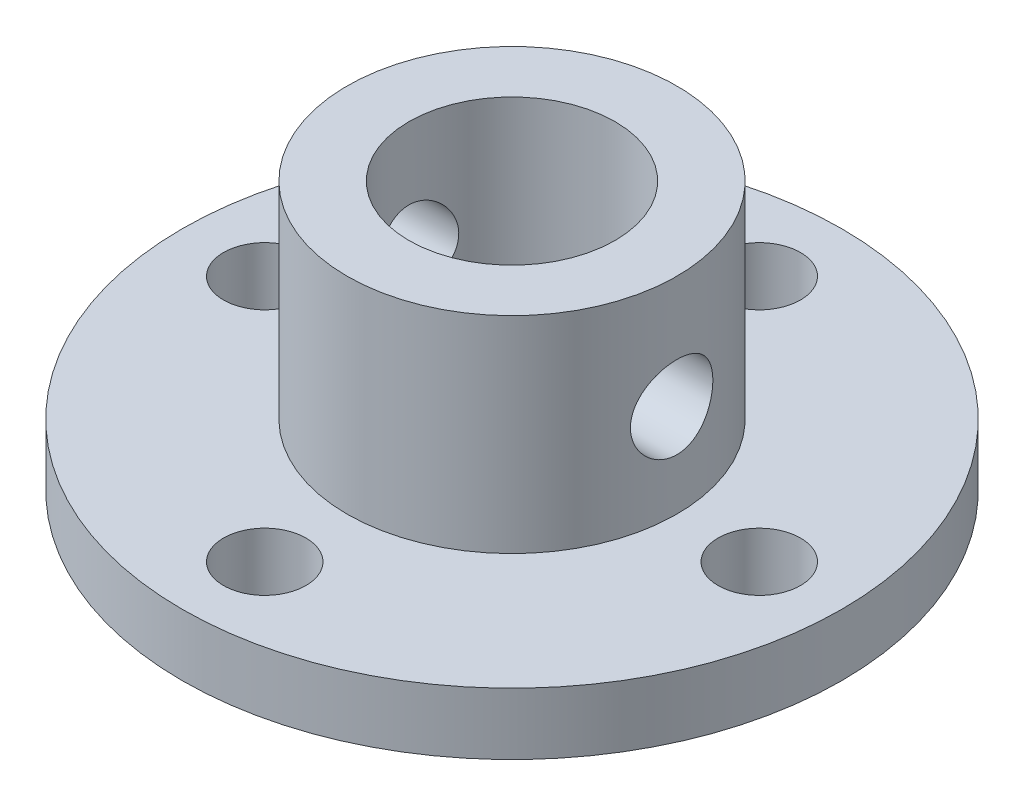
from build123d import *

# Parameters (mm, degrees)
SKETCH_1_R               = 16
SKETCH_1_R_2             = 2
SKETCH_1_R_3             = 5
EXTRUDE_1_DEPTH          = 3
SKETCH_2_R               = 8
SKETCH_2_R_2             = 5
EXTRUDE_2_DEPTH          = 10
CUT_EXTRUDE_1_DEPTH      = 10
CUT_EXTRUDE_1_DEPTH_BACK = 10
SKETCH_3_R               = 2


with BuildPart() as part:
    # 草图1 → 凸台-拉伸1 (new body)
    with BuildSketch(Plane(origin=(0, 0, 0), x_dir=(1, 0, 0), z_dir=(0, 1, 0))):
        Circle(SKETCH_1_R)
        with Locations((0, 12)):
            Circle(SKETCH_1_R_2, mode=Mode.SUBTRACT)
        with Locations((12, 0)):
            Circle(SKETCH_1_R_2, mode=Mode.SUBTRACT)
        with Locations((0, -12)):
            Circle(SKETCH_1_R_2, mode=Mode.SUBTRACT)
        with Locations((-12, 0)):
            Circle(SKETCH_1_R_2, mode=Mode.SUBTRACT)
        Circle(SKETCH_1_R_3, mode=Mode.SUBTRACT)
    extrude(amount=EXTRUDE_1_DEPTH)

    # 草图2 → 凸台-拉伸2 (add)
    with BuildSketch(Plane(origin=(0, 3, 0), x_dir=(1, 0, 0), z_dir=(0, 1, 0))):
        Circle(SKETCH_2_R)
        Circle(SKETCH_2_R_2, mode=Mode.SUBTRACT)
    extrude(amount=EXTRUDE_2_DEPTH)

    # 草图3 → 切除-拉伸1 (cut, two sides: drawn at the far end of the back side and taken through both)
    with BuildSketch(Plane(origin=(0, 0, 0), x_dir=(0, 0, -1), z_dir=(1, 0, 0)).offset(-CUT_EXTRUDE_1_DEPTH_BACK)):
        with Locations((0, 7.5)):
            Circle(SKETCH_3_R)
    extrude(amount=CUT_EXTRUDE_1_DEPTH + CUT_EXTRUDE_1_DEPTH_BACK, mode=Mode.SUBTRACT)


solid = part.part
